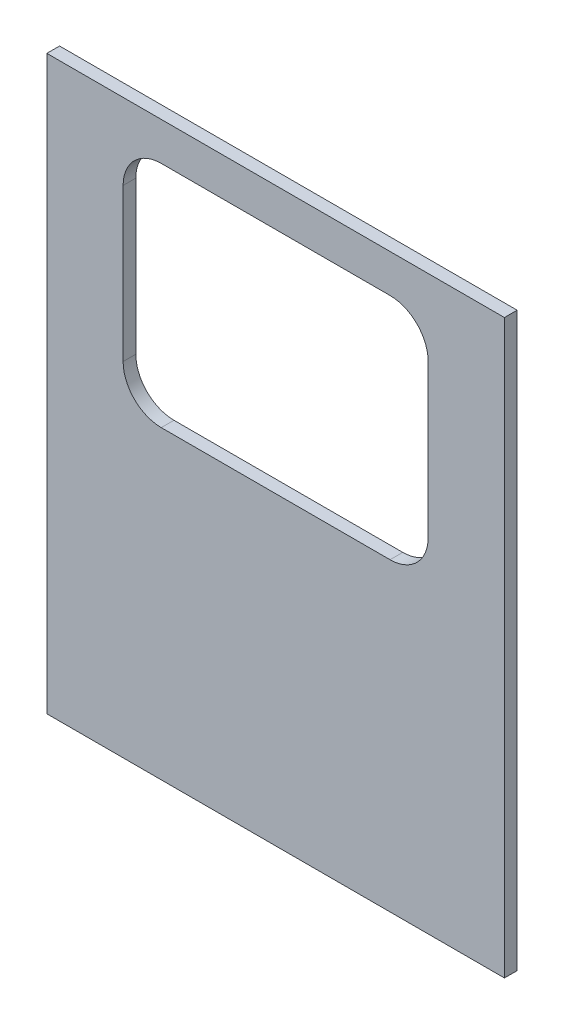
from build123d import *

# Parameters (mm, degrees)
SKETCH1_W           = 914.4
SKETCH1_H           = 1143
SKETCH1_W_2         = 609.6
SKETCH1_H_2         = 457.2
BOSS_EXTRUDE1_DEPTH = 25.4
FILLET1_R           = 76.2


with BuildPart() as part:
    # Sketch1 → Boss-Extrude1 (new body)
    with BuildSketch(Plane.XY):
        Rectangle(SKETCH1_W, SKETCH1_H)
        with Locations((0, 266.7)):
            Rectangle(SKETCH1_W_2, SKETCH1_H_2, mode=Mode.SUBTRACT)
    extrude(amount=BOSS_EXTRUDE1_DEPTH)

    # Fillet1
    fillet1_edges = [part.edges().sort_by_distance(p)[0] for p in [
        (304.8, 495.3, 12.7),
        (-304.8, 495.3, 12.7),
        (304.8, 38.1, 12.7),
        (-304.8, 38.1, 12.7),
    ]]
    fillet(fillet1_edges, radius=FILLET1_R)


solid = part.part
